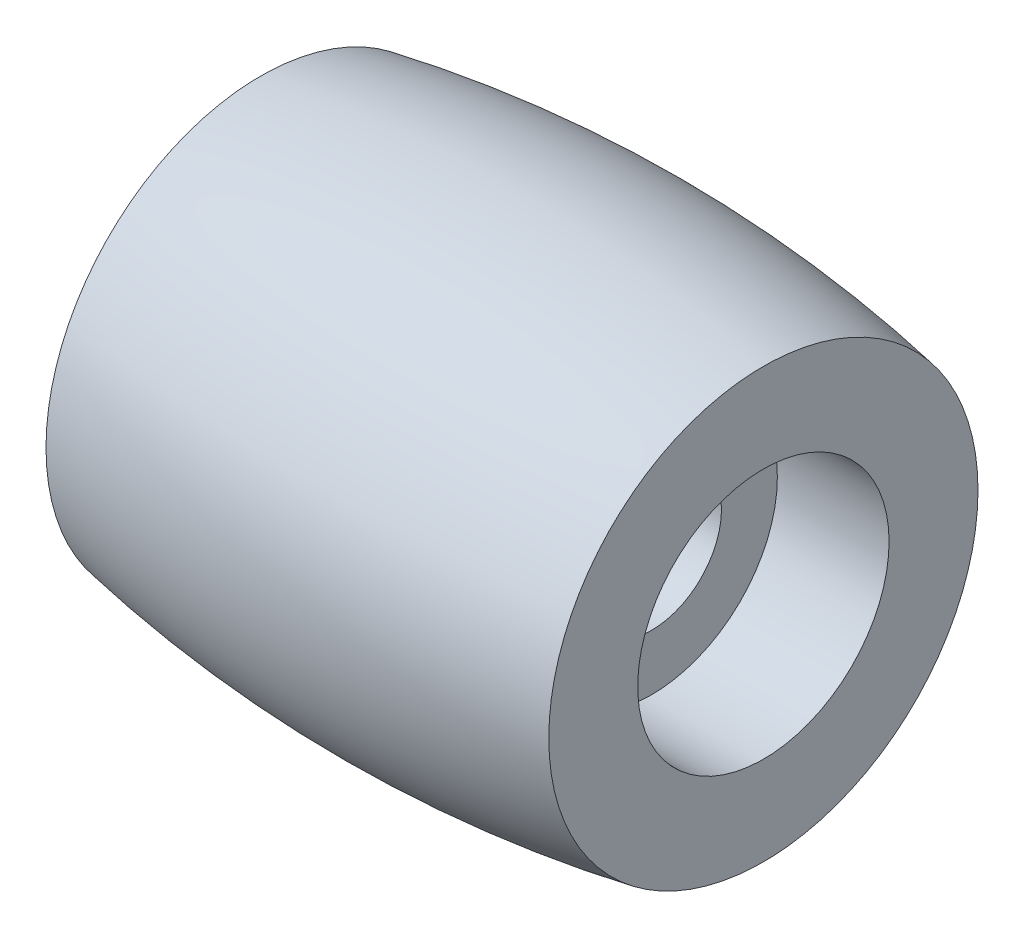
from build123d import *

# Parameters (mm, degrees)
SKETCH_2_R          = 2.5
CUT_EXTRUDE_1_DEPTH = 22.644860984
SKETCH_3_R          = 4.5
CUT_EXTRUDE_2_DEPTH = 4


with BuildPart() as part:
    # 草圖1 → 旋轉1 (revolve)
    with BuildSketch(Plane.XY):
        with BuildLine():
            Line((-9, 0), (9, 0))
            Line((9, 0), (9, 7.683330509))
            ThreePointArc((9, 7.683330509), (0, 8.5), (-9, 7.683330509))
            Line((-9, 7.683330509), (-9, 0))
        make_face()
    revolve(axis=Axis((-9, 0, 0), (1, 0, 0)))

    # 草圖2 → 除料-伸長1 (cut, through all)
    with BuildSketch(Plane(origin=(9, 0, 0), x_dir=(0, 0, -1), z_dir=(1, 0, 0))):
        Circle(SKETCH_2_R)
    extrude(amount=-CUT_EXTRUDE_1_DEPTH, mode=Mode.SUBTRACT)

    # 草圖3 → 除料-伸長2 (cut)
    with BuildSketch(Plane(origin=(9, 0, 0), x_dir=(0, 0, -1), z_dir=(1, 0, 0))):
        Circle(SKETCH_3_R)
    cut_extrude_2 = extrude(amount=-CUT_EXTRUDE_2_DEPTH, mode=Mode.SUBTRACT)

    # 鏡射1: 除料-伸長2 across plane
    add(cut_extrude_2.mirror(Plane(origin=(0, 0, 0), x_dir=(0, 0, 1), z_dir=(1, 0, 0))), mode=Mode.SUBTRACT)


solid = part.part
